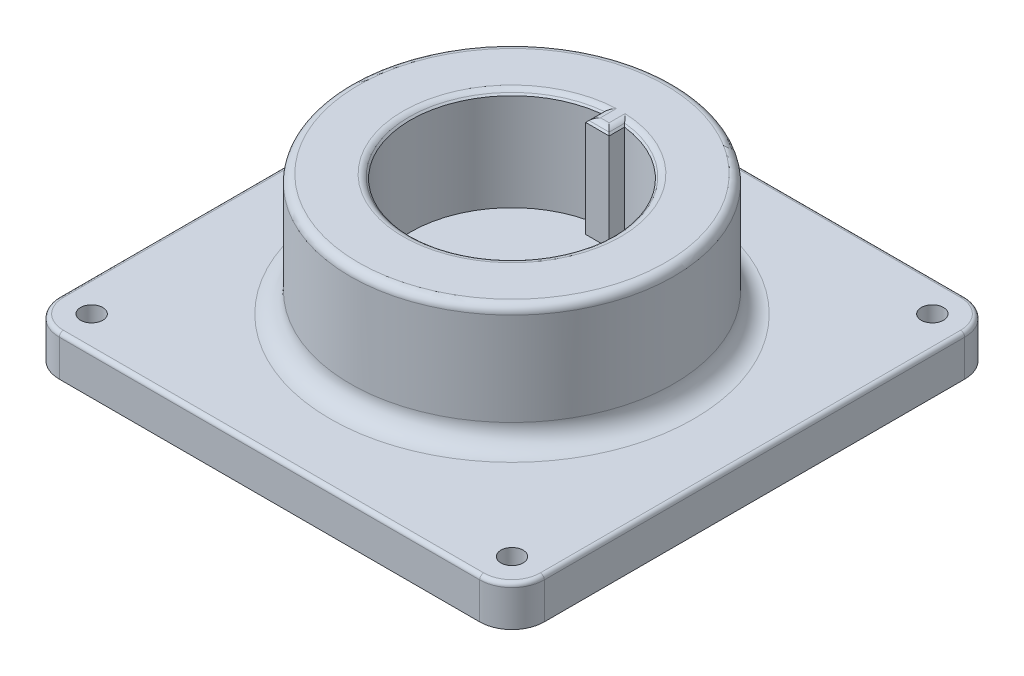
from build123d import *

# Parameters (mm, degrees)
SKETCH1_W           = 120
SKETCH1_H           = 120
BOSS_EXTRUDE1_DEPTH = 10
SKETCH2_R           = 2.75
CUT_EXTRUDE1_DEPTH  = 86.440037453
CIRPATTERN1_COUNT   = 4
FILLET1_R           = 8
FILLET2_R           = 1
SKETCH3_R           = 40
BOSS_EXTRUDE2_DEPTH = 30
SKETCH4_R           = 25.1
CUT_EXTRUDE2_DEPTH  = 25
BOSS_EXTRUDE3_REACH = 95.808
CHAMFER1_SIZE       = 1
FILLET3_R           = 2
FILLET4_R           = 5


with BuildPart() as part:
    # Sketch1 → Boss-Extrude1 (new body)
    with BuildSketch(Plane(origin=(0, 0, 0), x_dir=(1, 0, 0), z_dir=(0, 1, 0))):
        Rectangle(SKETCH1_W, SKETCH1_H)
    extrude(amount=BOSS_EXTRUDE1_DEPTH)

    # Sketch2 → Cut-Extrude1 (cut, through all)
    with BuildSketch(Plane(origin=(0, 10, 0), x_dir=(1, 0, 0), z_dir=(0, 1, 0))):
        with Locations((-52, 52)):
            Circle(SKETCH2_R)
    cut_extrude1 = extrude(amount=-CUT_EXTRUDE1_DEPTH, mode=Mode.SUBTRACT)

    # CirPattern1: Cut-Extrude1 ×4 about axis
    cirpattern1_axis = Axis((0, 0, 0), (0, 1, 0))
    for i in range(1, CIRPATTERN1_COUNT):
        add(cut_extrude1.rotate(cirpattern1_axis, i * 360 / CIRPATTERN1_COUNT), mode=Mode.SUBTRACT)

    # Fillet1
    fillet1_edges = [part.edges().sort_by_distance(p)[0] for p in [
        (-60, 5, 60),
        (60, 5, 60),
        (60, 5, -60),
        (-60, 5, -60),
    ]]
    fillet(fillet1_edges, radius=FILLET1_R)

    # Fillet2
    fillet2_edges = [part.edges().sort_by_distance(p)[0] for p in [
        (-57.656854249, 10, -57.656854249),
        (0, 10, -60),
        (57.656854249, 10, -57.656854249),
        (60, 10, 0),
        (57.656854249, 10, 57.656854249),
        (0, 10, 60),
        (-57.656854249, 10, 57.656854249),
        (-60, 10, 0),
    ]]
    fillet(fillet2_edges, radius=FILLET2_R)

    # Sketch3 → Boss-Extrude2 (add)
    with BuildSketch(Plane(origin=(0, 10, 0), x_dir=(1, 0, 0), z_dir=(0, 1, 0))):
        Circle(SKETCH3_R)
    extrude(amount=BOSS_EXTRUDE2_DEPTH)

    # Sketch4 → Cut-Extrude2 (cut)
    with BuildSketch(Plane(origin=(0, 40, 0), x_dir=(1, 0, 0), z_dir=(0, 1, 0))):
        Circle(SKETCH4_R)
    extrude(amount=-CUT_EXTRUDE2_DEPTH, mode=Mode.SUBTRACT)

    # Sketch5 → Boss-Extrude3 (add, up to next)
    with BuildSketch(Plane(origin=(0, 40, 0), x_dir=(1, 0, 0), z_dir=(0, 1, 0)), mode=Mode.PRIVATE) as boss_extrude3_sk1:
        with BuildLine():
            Line((2.9, 21.131907268), (-2.9, 21.131907268))
            Line((-2.9, 21.131907268), (-2.9, 24.931907268))
            ThreePointArc((-2.9, 24.931907268), (0, 25.1), (2.9, 24.931907268))
            Line((2.9, 24.931907268), (2.9, 21.131907268))
        make_face()
    boss_extrude3_tool1 = extrude(boss_extrude3_sk1.sketch, amount=-BOSS_EXTRUDE3_REACH, mode=Mode.PRIVATE) - part.part
    add(boss_extrude3_tool1.solids().sort_by_distance((0, 40, -23.088296))[0])

    # Chamfer1
    chamfer1_edges = [part.edges().sort_by_distance(p)[0] for p in [
        (-2.9, 40, -23.031907268),
        (0, 40, -21.131907268),
        (2.9, 40, -23.031907268),
        (0, 40, 25.1),
    ]]
    chamfer(chamfer1_edges, length=CHAMFER1_SIZE)

    # Fillet3
    fillet3_edges = [part.edges().sort_by_distance(p)[0] for p in [
        (-40, 40, 0),
        (1.9, 40, -24.081329157),
        (0, 40, -22.131907268),
        (-1.9, 40, -24.081329157),
        (0, 40, 26.1),
    ]]
    fillet(fillet3_edges, radius=FILLET3_R)

    # Fillet4
    fillet4_edges = [part.edges().sort_by_distance(p)[0] for p in [
        (-40, 10, 0),
    ]]
    fillet(fillet4_edges, radius=FILLET4_R)


solid = part.part
